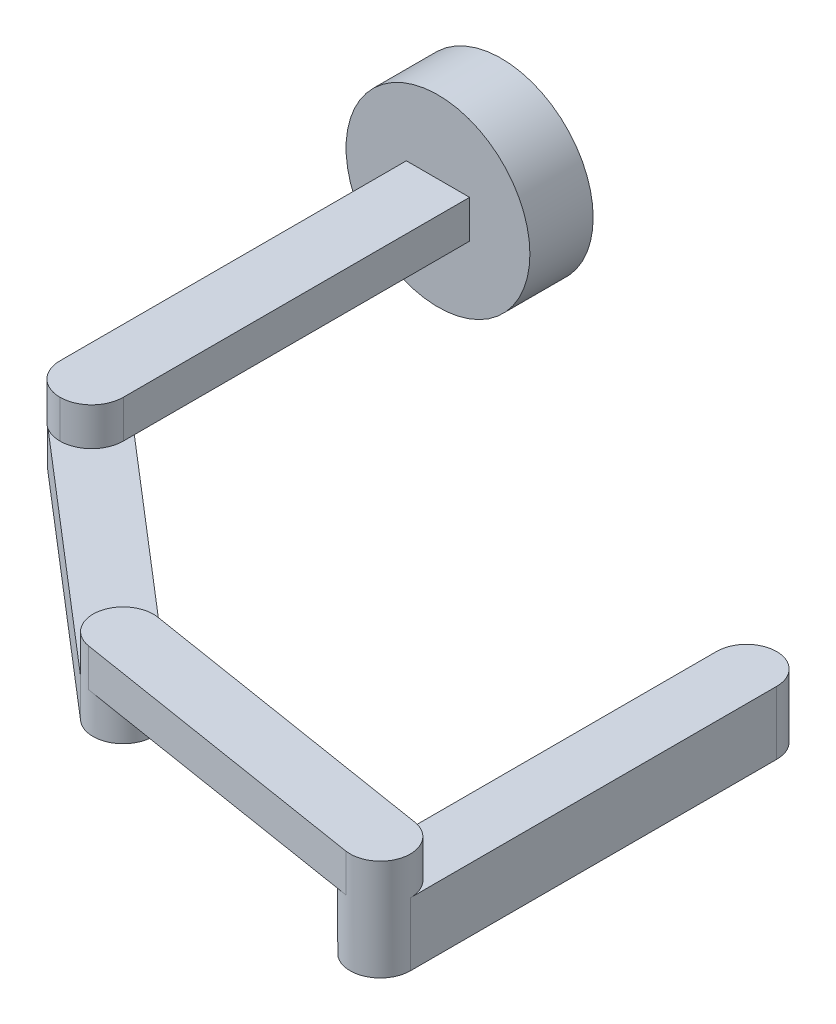
from build123d import *

# Parameters (mm, degrees)
SKETCH1_R           = 29.060848553
BOSS_EXTRUDE1_DEPTH = 20
SKETCH2_W           = 20
SKETCH2_H           = 12
BOSS_EXTRUDE2_DEPTH = 139.5
FILLET2_R           = 10
BOSS_EXTRUDE3_DEPTH = 12
BOSS_EXTRUDE4_START = 12
BOSS_EXTRUDE4_DEPTH = 12
BOSS_EXTRUDE6_DEPTH = 20


with BuildPart() as part:
    # Sketch1 → Boss-Extrude1 (new body)
    with BuildSketch(Plane.XY):
        Circle(SKETCH1_R)
    extrude(amount=-BOSS_EXTRUDE1_DEPTH)

    # Sketch2 → Boss-Extrude2 (add)
    with BuildSketch(Plane(origin=(0, 0, -20), x_dir=(-1, 0, 0), z_dir=(0, 0, -1))):
        Rectangle(SKETCH2_W, SKETCH2_H)
    extrude(amount=-BOSS_EXTRUDE2_DEPTH)

    # Fillet2
    # the kernel refuses this fillet: 10 mm, written as the material it takes off along each edge
    with BuildSketch(Plane(origin=(10, -31, 119.5), x_dir=(0, 0, -1), z_dir=(0, 1, 0)), Plane(origin=(-10, 31, 119.5), x_dir=(0, 0, -1), z_dir=(0, -1, 0))) as fillet2_piece_1:
        with BuildLine():
            CenterArc((FILLET2_R, FILLET2_R), FILLET2_R, 180, 90)
            Line((0, FILLET2_R), (0, 0))
            Line((0, 0), (FILLET2_R, 0))
        make_face()
    extrude(amount=62, mode=Mode.SUBTRACT)

    # Sketch3 → Boss-Extrude3 (add)
    with BuildSketch(Plane.XZ.offset(6)):
        with BuildLine():
            Line((6.20869835, 102.749264082), (80.315076986, 166.416639129))
            ThreePointArc((80.315076986, 166.416639129), (81.332881571, 179.849603019), (67.899917681, 180.867407604))
            Line((67.899917681, 180.867407604), (-6.206460955, 117.200032557))
            ThreePointArc((-6.206460955, 117.200032557), (-7.224082117, 103.769489485), (6.206460955, 102.751868323))
            Line((6.206460955, 102.751868323), (6.20869835, 102.749264082))
        make_face()
    extrude(amount=BOSS_EXTRUDE3_DEPTH)

    # Sketch4 → Boss-Extrude4 (add)
    with BuildSketch(Plane(origin=(0, -6, 0), x_dir=(1, 0, 0), z_dir=(0, 1, 0)).offset(BOSS_EXTRUDE4_START)):
        with BuildLine():
            Line((72.601205927, -183.04794218), (169.39785175, -198.549240748))
            ThreePointArc((169.39785175, -198.549240748), (180.31006197, -190.649613341), (172.410434564, -179.737403121))
            Line((172.410434564, -179.737403121), (75.613788741, -164.236104553))
            ThreePointArc((75.613788741, -164.236104553), (64.70157852, -172.13573196), (72.601205927, -183.04794218))
        make_face()
    extrude(amount=-BOSS_EXTRUDE4_DEPTH)

    # Sketch5 → Boss-Extrude6 (add)
    with BuildSketch(Plane.XZ.offset(6)):
        with BuildLine():
            Line((161.378376914, 189.143321934), (161.378376914, 73.343321934))
            ThreePointArc((161.378376914, 73.343321934), (170.904143157, 63.817555691), (180.429909401, 73.343321934))
            Line((180.429909401, 73.343321934), (180.429909401, 189.143321934))
            ThreePointArc((180.429909401, 189.143321934), (170.904143157, 198.669088178), (161.378376914, 189.143321934))
        make_face()
    extrude(amount=BOSS_EXTRUDE6_DEPTH)


solid = part.part
